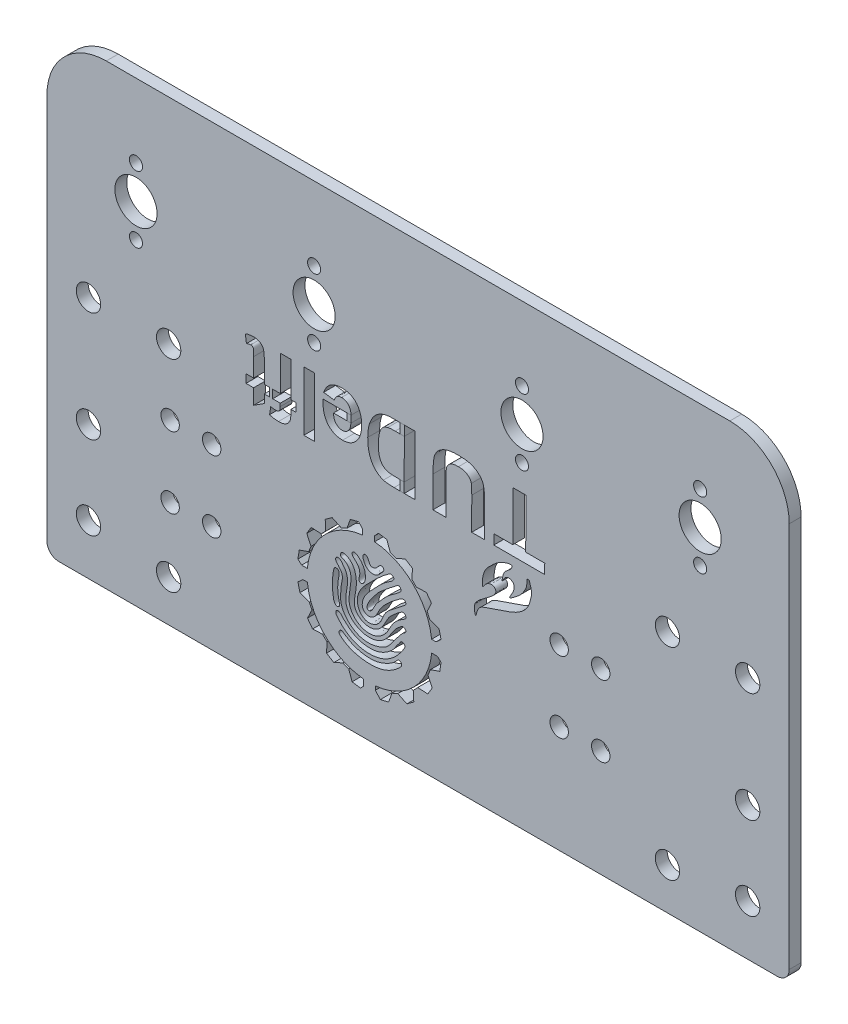
from build123d import *

# Parameters (mm, degrees)
SKETCH1_W             = 125
SKETCH1_H             = 77
SKETCH1_R             = 3.55
SKETCH1_R_2           = 1.1
SKETCH1_R_3           = 2.05
SKETCH1_R_4           = 1.55
BOSS_EXTRUDE1_DEPTH   = 2
FILLET1_R             = 10
FILLET2_R             = 2
CUT_EXTRUDE1_START    = -2
CUT_EXTRUDE1_DEPTH    = 2
SKETCH4_W             = 0.7
SKETCH4_H             = 1.666262253
BOSS_EXTRUDE2_DEPTH   = 2
SKETCH4_W_2           = 0.689492997
SKETCH4_H_2           = 1.664070352
BOSS_EXTRUDE2_2_DEPTH = 2
SKETCH4_H_3           = 1.151697465
BOSS_EXTRUDE2_3_DEPTH = 2
CUT_EXTRUDE3_DEPTH    = 147.826428278
SKETCH8_W             = 2
SKETCH8_H             = 2
BOSS_EXTRUDE3_DEPTH   = 2


# Read off the part's stored shape, not the designer's step: Cut-Extrude1
with BuildPart() as part:
    # Sketch1 → Boss-Extrude1 (new body)
    with BuildSketch(Plane.XY):
        with Locations((62.5, 38.5)):
            Rectangle(SKETCH1_W, SKETCH1_H)
        with Locations((15, 59)):
            Circle(SKETCH1_R, mode=Mode.SUBTRACT)
        with Locations((45, 59)):
            Circle(SKETCH1_R, mode=Mode.SUBTRACT)
        with Locations((80, 59)):
            Circle(SKETCH1_R, mode=Mode.SUBTRACT)
        with Locations((110, 59)):
            Circle(SKETCH1_R, mode=Mode.SUBTRACT)
        with Locations((15, 64.6)):
            Circle(SKETCH1_R_2, mode=Mode.SUBTRACT)
        with Locations((45, 64.6)):
            Circle(SKETCH1_R_2, mode=Mode.SUBTRACT)
        with Locations((80, 64.6)):
            Circle(SKETCH1_R_2, mode=Mode.SUBTRACT)
        with Locations((110, 64.6)):
            Circle(SKETCH1_R_2, mode=Mode.SUBTRACT)
        with Locations(Location((110, 53.4, 0), (0, 0, 180))):
            Circle(SKETCH1_R_2, mode=Mode.SUBTRACT)
        with Locations(Location((80, 53.4, 0), (0, 0, 180))):
            Circle(SKETCH1_R_2, mode=Mode.SUBTRACT)
        with Locations(Location((45, 53.4, 0), (0, 0, 180))):
            Circle(SKETCH1_R_2, mode=Mode.SUBTRACT)
        with Locations(Location((15, 53.4, 0), (0, 0, 180))):
            Circle(SKETCH1_R_2, mode=Mode.SUBTRACT)
        with Locations((7, 8.5)):
            Circle(SKETCH1_R_3, mode=Mode.SUBTRACT)
        with Locations((7, 22.5)):
            Circle(SKETCH1_R_3, mode=Mode.SUBTRACT)
        with Locations(Location((118, 8.5, 0), (0, 0, 180))):
            Circle(SKETCH1_R_3, mode=Mode.SUBTRACT)
        with Locations(Location((118, 22.5, 0), (0, 0, 180))):
            Circle(SKETCH1_R_3, mode=Mode.SUBTRACT)
        with Locations((20.5, 7)):
            Circle(SKETCH1_R_3, mode=Mode.SUBTRACT)
        with Locations((20.5, 41)):
            Circle(SKETCH1_R_3, mode=Mode.SUBTRACT)
        with Locations(Location((104.5, 7, 0), (0, 0, 180))):
            Circle(SKETCH1_R_3, mode=Mode.SUBTRACT)
        with Locations(Location((104.5, 41, 0), (0, 0, 180))):
            Circle(SKETCH1_R_3, mode=Mode.SUBTRACT)
        with Locations((20.75, 18)):
            Circle(SKETCH1_R_4, mode=Mode.SUBTRACT)
        with Locations((20.75, 30)):
            Circle(SKETCH1_R_4, mode=Mode.SUBTRACT)
        with Locations(Location((27.75, 18, 0), (0, 0, 180))):
            Circle(SKETCH1_R_4, mode=Mode.SUBTRACT)
        with Locations(Location((27.75, 30, 0), (0, 0, 180))):
            Circle(SKETCH1_R_4, mode=Mode.SUBTRACT)
        with Locations(Location((93.26, 18, 0), (0, 0, 180))):
            Circle(SKETCH1_R_4, mode=Mode.SUBTRACT)
        with Locations((86.26, 18)):
            Circle(SKETCH1_R_4, mode=Mode.SUBTRACT)
        with Locations((86.26, 30)):
            Circle(SKETCH1_R_4, mode=Mode.SUBTRACT)
        with Locations(Location((93.26, 30, 0), (0, 0, 180))):
            Circle(SKETCH1_R_4, mode=Mode.SUBTRACT)
        with Locations((7, 41)):
            Circle(SKETCH1_R_3, mode=Mode.SUBTRACT)
        with Locations(Location((118, 41, 0), (0, 0, 180))):
            Circle(SKETCH1_R_3, mode=Mode.SUBTRACT)
    extrude(amount=BOSS_EXTRUDE1_DEPTH)

    # Fillet1
    fillet1_edges = [part.edges().sort_by_distance(p)[0] for p in [
        (0, 77, 1),
        (125, 77, 1),
    ]]
    fillet(fillet1_edges, radius=FILLET1_R)

    # Fillet2
    fillet2_edges = [part.edges().sort_by_distance(p)[0] for p in [
        (125, 0, 1),
        (0, 0, 1),
    ]]
    fillet(fillet2_edges, radius=FILLET2_R)

    # Cut-Extrude1 outline → Cut-Extrude1 (cut)
    # profile 1 of 8: a face of its own
    with BuildSketch(Plane.XY.offset(2).offset(CUT_EXTRUDE1_START)):
        with BuildLine():
            add(Edge.make_bspline(
                [(81.251849288, 36.779414646), (81.247492129, 36.793378665), (81.207860576, 36.920021075), (80.799858004, 36.936688031), (80.821470647, 36.158449824), (80.80355112, 35.72482003), (80.374288953, 34.842498814), (79.881322011, 33.965258168), (77.381519863, 32.108766034), (78.597227158, 33.814279643), (78.956419225, 35.207259954), (77.21487199, 35.799499393), (76.547216037, 34.009253907), (76.81133602, 35.721809813), (77.177430618, 36.200279324), (78.069672729, 36.842957133), (78.761206511, 37.9588554), (76.100214252, 37.11203143), (74.944444523, 35.895544614), (73.336810133, 34.586035364), (73.207606047, 31.368349434), (73.760556003, 32.595590649), (74.936894361, 33.354106323), (76.139314494, 32.483671262), (74.151639075, 30.665966882), (72.784475727, 29.925580038), (72.088655851, 28.969143053), (71.914491564, 28.197404019), (72.183600749, 26.5403403), (72.500602899, 28.662113501), (73.965399773, 29.329932162), (76.951764861, 30.23566165), (79.0588748, 31.040106485), (81.022711601, 32.13723034), (81.572119528, 34.925789731), (81.777134866, 35.095955911), (81.251849288, 36.779414646)],
                knots=[0, 0, 0, 0, 0.00044067, 0.003966029, 0.005792626, 0.016880037, 0.021185448, 0.047460814, 0.081891789, 0.097295951, 0.12222596, 0.142929522, 0.159138332, 0.171893127, 0.194958669, 0.199517328, 0.21747972, 0.249139263, 0.287651076, 0.330737406, 0.364299818, 0.378924647, 0.385204396, 0.4270973, 0.476991153, 0.564177334, 0.57652011, 0.582583858, 0.624814808, 0.652752163, 0.702203053, 0.787421301, 0.811298129, 0.926563203, 0.946874204, 1, 1, 1, 1], degree=3))
        make_face()
    # profile 2 of 8: a face of its own
    with BuildSketch(Plane.XY.offset(2).offset(CUT_EXTRUDE1_START)):
        with BuildLine():
            add(Edge.make_bspline(
                [(41.084474532, 41.207127847), (41.084386211, 41.13639444), (41.084214466, 40.998851018), (41.072629339, 40.800050181), (41.059076668, 40.614441854), (41.03958516, 40.443364582), (41.012057676, 40.286186183), (40.984373097, 40.142289427), (40.944217791, 40.013516474), (40.890388325, 39.858880565), (40.794162454, 39.683342625), (40.644669499, 39.492268284), (40.452029215, 39.326786864), (40.22645285, 39.180257381), (39.965576689, 39.059669154), (39.66860801, 38.978433696), (39.341608255, 38.925362291), (39.11239838, 38.921064057), (38.993413093, 38.918832797)],
                knots=[0, 0, 0, 0, 0.058895809, 0.114524827, 0.165787414, 0.213890617, 0.257824887, 0.298686706, 0.335778729, 0.370050499, 0.434924525, 0.501392028, 0.571063427, 0.645341039, 0.724890297, 0.809297033, 0.901004059, 1, 1, 1, 1], degree=3))
            Line((41.084474532, 41.207127847), (41.085304863, 41.733492593))
            Line((41.085304863, 41.733492593), (41.981926178, 41.732078188))
            Line((41.981926178, 41.732078188), (41.984148814, 43.141054541))
            Line((41.984148814, 43.141054541), (41.087527498, 43.142468945))
            Line((41.087527498, 43.142468945), (41.096822155, 49.034551874))
            Line((41.096822155, 49.034551874), (39.303579524, 49.037380683))
            Line((39.303579524, 49.037380683), (39.294284868, 43.145297754))
            Line((39.294284868, 43.145297754), (38.013397274, 43.147318331))
            Line((38.013397274, 43.147318331), (38.011174639, 41.738341978))
            Line((38.011174639, 41.738341978), (39.292062233, 41.736321401))
            Line((39.292062233, 41.736321401), (39.291279259, 41.239977459))
            add(Edge.make_bspline(
                [(38.539319523, 40.32852898), (38.601489516, 40.330662211), (38.71756742, 40.334645175), (38.879621508, 40.366418581), (39.012815429, 40.427170666), (39.123759743, 40.512134412), (39.202313777, 40.637874365), (39.25404868, 40.801664113), (39.287643389, 41.006505305), (39.289999029, 41.157769338), (39.291279259, 41.239977459)],
                knots=[0, 0, 0, 0, 0.134991868, 0.252043989, 0.35574181, 0.450528209, 0.550967798, 0.671899199, 0.821685633, 1, 1, 1, 1], degree=3))
            add(Edge.make_bspline(
                [(37.688900592, 40.437945661), (37.833031986, 40.405693858), (38.113180047, 40.343006059), (38.400042773, 40.333260578), (38.539319523, 40.32852898)],
                knots=[0, 0, 0, 0, 0.514482929, 1, 1, 1, 1], degree=3))
            Line((37.688900592, 40.437945661), (37.494743718, 39.155359767))
            add(Edge.make_bspline(
                [(38.993413093, 38.918832797), (38.866526539, 38.921539382), (38.613318059, 38.926940508), (38.235394177, 38.973883704), (37.861148771, 39.046880828), (37.61694527, 39.119180423), (37.494743718, 39.155359767)],
                knots=[0, 0, 0, 0, 0.249849339, 0.498586885, 0.749088524, 1, 1, 1, 1], degree=3))
        make_face()
    # profile 3 of 8: a face of its own
    with BuildSketch(Plane.XY.offset(2).offset(CUT_EXTRUDE1_START)):
        with BuildLine():
            add(Edge.make_bspline(
                [(34.816128706, 46.290544378), (34.8164704, 46.365930753), (34.817114494, 46.50803407), (34.814668856, 46.708837054), (34.813657466, 46.884980939), (34.810212631, 47.036464306), (34.804111519, 47.163205208), (34.798269648, 47.264621911), (34.793415461, 47.341541208), (34.780363137, 47.434961247), (34.732204272, 47.548402483), (34.647236215, 47.649596669), (34.559367743, 47.707818909), (34.486379122, 47.740168864), (34.406697809, 47.761715023), (34.350938704, 47.763450668), (34.322108428, 47.764348084)],
                knots=[0, 0, 0, 0, 0.129479547, 0.244068946, 0.344909085, 0.432022823, 0.504292334, 0.562831021, 0.606508296, 0.636650554, 0.72452958, 0.813890151, 0.859335254, 0.904475985, 0.950609254, 1, 1, 1, 1], degree=3))
            Line((34.816128706, 46.290544378), (34.811178291, 43.152369775))
            Line((34.811178291, 43.152369775), (33.530290698, 43.154390352))
            Line((33.530290698, 43.154390352), (33.528068063, 41.745414))
            Line((33.528068063, 41.745414), (34.808955656, 41.743393422))
            Line((34.808955656, 41.743393422), (34.804914501, 39.181618235))
            Line((34.804914501, 39.181618235), (36.599975651, 40.331588261))
            Line((36.599975651, 40.331588261), (36.602198287, 41.740564614))
            Line((36.602198287, 41.740564614), (37.498819602, 41.739150209))
            Line((37.498819602, 41.739150209), (37.501042237, 43.148126562))
            Line((37.501042237, 43.148126562), (36.604420922, 43.149540966))
            Line((36.604420922, 43.149540966), (36.60952288, 46.383782139))
            add(Edge.make_bspline(
                [(36.553664253, 47.76683202), (36.558571956, 47.734839262), (36.56947969, 47.663732985), (36.58043371, 47.545441011), (36.590137101, 47.405293071), (36.597586153, 47.2431197), (36.603345354, 47.058962959), (36.606063088, 46.853445392), (36.611130656, 46.625971122), (36.610076495, 46.467176484), (36.60952288, 46.383782139)],
                knots=[0, 0, 0, 0, 0.070080146, 0.155758322, 0.257146461, 0.374311476, 0.507296469, 0.656130797, 0.819409856, 1, 1, 1, 1], degree=3))
            add(Edge.make_bspline(
                [(34.842690261, 49.172506735), (34.922170968, 49.169816), (35.077781056, 49.164547988), (35.306137774, 49.13232797), (35.522148287, 49.075978372), (35.723588927, 48.998402062), (35.904455388, 48.901888706), (36.064878532, 48.795254689), (36.195946503, 48.670467498), (36.306349438, 48.533632365), (36.389951206, 48.373126632), (36.461581205, 48.193566866), (36.517295585, 47.988541646), (36.541141329, 47.843173908), (36.553664253, 47.76683202)],
                knots=[0, 0, 0, 0, 0.096742541, 0.189405906, 0.279993555, 0.367899867, 0.451434128, 0.529129617, 0.601505434, 0.670867358, 0.742081635, 0.820784529, 0.905882505, 1, 1, 1, 1], degree=3))
            add(Edge.make_bspline(
                [(33.411297694, 48.920587967), (33.519311968, 48.960416787), (33.738467854, 49.041227591), (34.088785913, 49.114993226), (34.458257379, 49.164844967), (34.712408603, 49.169910214), (34.842690261, 49.172506735)],
                knots=[0, 0, 0, 0, 0.235963478, 0.478758812, 0.732804096, 1, 1, 1, 1], degree=3))
            Line((33.411297694, 48.920587967), (33.601318698, 47.581357068))
            add(Edge.make_bspline(
                [(34.322108428, 47.764348084), (34.275934833, 47.761488572), (34.173279176, 47.755131149), (34.006456097, 47.718279215), (33.812283849, 47.659678969), (33.675132345, 47.608760765), (33.601318698, 47.581357068)],
                knots=[0, 0, 0, 0, 0.185578673, 0.412588643, 0.683860748, 1, 1, 1, 1], degree=3))
        make_face()
    # profile 4 of 8: a face of its own
    with BuildSketch(Plane.XY.offset(2).offset(CUT_EXTRUDE1_START)):
        with BuildLine():
            add(Edge.make_bspline(
                [(49.628715168, 47.740202184), (49.555783864, 47.737083644), (49.41452681, 47.731043497), (49.210859288, 47.687483307), (49.026005996, 47.61044408), (48.858035934, 47.502900698), (48.708501509, 47.359966956), (48.583034074, 47.177809426), (48.473245316, 46.962134275), (48.421444479, 46.801686421), (48.394244397, 46.717436915)],
                knots=[0, 0, 0, 0, 0.125553796, 0.243178969, 0.35646636, 0.468629864, 0.584815746, 0.710080156, 0.847766094, 1, 1, 1, 1], degree=3))
            add(Edge.make_bspline(
                [(51.210984756, 45.944459089), (51.207942269, 46.013233429), (51.202017572, 46.147159131), (51.179083927, 46.342944837), (51.139136344, 46.526238455), (51.086750677, 46.698144405), (51.02438996, 46.85877937), (50.944973054, 47.006612968), (50.853421857, 47.143521802), (50.747528452, 47.267279128), (50.631543413, 47.37717392), (50.509122548, 47.473782948), (50.380455875, 47.558293976), (50.24220302, 47.622633727), (50.098979942, 47.677003168), (49.948191882, 47.711946242), (49.790860771, 47.735255968), (49.683503507, 47.738530878), (49.628715168, 47.740202184)],
                knots=[0, 0, 0, 0, 0.076984766, 0.149914034, 0.220164116, 0.286488465, 0.350779578, 0.412535306, 0.473793179, 0.534654409, 0.594295888, 0.652213479, 0.708926548, 0.765996814, 0.822414602, 0.879965744, 0.938742127, 1, 1, 1, 1], degree=3))
            Line((51.210984756, 45.944459089), (46.471700661, 45.951935225))
            add(Edge.make_bspline(
                [(49.791135666, 41.591670221), (49.664204995, 41.594596458), (49.41663849, 41.600303812), (49.055292437, 41.652566807), (48.714195643, 41.735920003), (48.394263121, 41.855269959), (48.09501605, 42.007395328), (47.815688028, 42.192160537), (47.558495866, 42.413434626), (47.321527556, 42.666134855), (47.111182208, 42.954827547), (46.928434542, 43.277784846), (46.777116464, 43.636894762), (46.656841781, 44.031771805), (46.563562367, 44.461612268), (46.50179166, 44.927510583), (46.46814644, 45.428376128), (46.470491111, 45.773760907), (46.471700661, 45.951935225)],
                knots=[0, 0, 0, 0, 0.060948577, 0.118874548, 0.174997402, 0.229351824, 0.282528423, 0.335951703, 0.389834463, 0.445160999, 0.502020273, 0.561013676, 0.62304474, 0.688834325, 0.759055579, 0.834115092, 0.91442463, 1, 1, 1, 1], degree=3))
            add(Edge.make_bspline(
                [(53.00340337, 45.419268309), (53.00055125, 45.273742332), (52.994978425, 44.989395714), (52.952522124, 44.575064033), (52.879979751, 44.184963903), (52.779517205, 43.820209902), (52.652773985, 43.478684456), (52.496748886, 43.161396121), (52.308275057, 42.870524864), (52.09629451, 42.604291718), (51.86137879, 42.367129407), (51.611497543, 42.157903324), (51.343911576, 41.983125233), (51.063364796, 41.837967884), (50.765595819, 41.728451957), (50.454448135, 41.648776828), (50.127623502, 41.599862498), (49.904726607, 41.594435755), (49.791135666, 41.591670221)],
                knots=[0, 0, 0, 0, 0.077699473, 0.151818822, 0.222108436, 0.289345562, 0.353596554, 0.416366914, 0.477732636, 0.538318944, 0.597768744, 0.655695171, 0.712013142, 0.768095143, 0.824007175, 0.881032759, 0.939372861, 1, 1, 1, 1], degree=3))
            add(Edge.make_bspline(
                [(52.318856943, 47.912081015), (52.374714468, 47.828405543), (52.487123124, 47.660015567), (52.621157658, 47.384633845), (52.744356123, 47.098186174), (52.837015025, 46.792618447), (52.915210047, 46.472915417), (52.963238858, 46.13558416), (52.999905415, 45.783017922), (53.002221875, 45.542131004), (53.00340337, 45.419268309)],
                knots=[0, 0, 0, 0, 0.114813113, 0.231051905, 0.349253341, 0.470748643, 0.595352963, 0.724928543, 0.859701718, 1, 1, 1, 1], degree=3))
            add(Edge.make_bspline(
                [(49.63293919, 49.149175379), (49.779237031, 49.145181966), (50.063699859, 49.137417138), (50.475509935, 49.077930402), (50.858291241, 48.982137212), (51.212261928, 48.847116313), (51.536441448, 48.671644124), (51.830522065, 48.456941785), (52.096454452, 48.205303941), (52.24420579, 48.010503606), (52.318856943, 47.912081015)],
                knots=[0, 0, 0, 0, 0.142445669, 0.276972629, 0.404305661, 0.526062398, 0.64497022, 0.762201009, 0.8798524, 1, 1, 1, 1], degree=3))
            add(Edge.make_bspline(
                [(46.601405882, 46.976443242), (46.631646302, 47.062934585), (46.69107156, 47.232898178), (46.800161094, 47.475530442), (46.923083721, 47.701201087), (47.055849562, 47.913138956), (47.201362321, 48.109612196), (47.363748792, 48.287564092), (47.535102268, 48.452314688), (47.720922927, 48.59855289), (47.918047147, 48.728498014), (48.126581434, 48.844054356), (48.349953378, 48.93601293), (48.583309459, 49.014428103), (48.828170055, 49.076345014), (49.085885135, 49.119606245), (49.355514553, 49.145597863), (49.539478334, 49.147970159), (49.63293919, 49.149175379)],
                knots=[0, 0, 0, 0, 0.068274766, 0.134166313, 0.198024248, 0.259697498, 0.320465937, 0.37997611, 0.439067186, 0.497470019, 0.555949018, 0.614924896, 0.674867742, 0.735725641, 0.79832223, 0.862907926, 0.93035182, 1, 1, 1, 1], degree=3))
            Line((46.601405882, 46.976443242), (48.394244397, 46.717436915))
        make_face()
        with BuildLine():
            add(Edge.make_bspline(
                [(48.263124772, 44.796307583), (48.266319886, 44.725546404), (48.272542595, 44.587734067), (48.293233009, 44.386785691), (48.329000095, 44.199461383), (48.37615739, 44.024757016), (48.439195309, 43.864815267), (48.509619531, 43.715068221), (48.596062737, 43.580161565), (48.695139658, 43.460410284), (48.799676945, 43.350931705), (48.915280855, 43.25984794), (49.032186691, 43.178313608), (49.15645852, 43.113023905), (49.286806451, 43.063086675), (49.422787791, 43.026308216), (49.564646163, 43.006491929), (49.660548891, 43.002704483), (49.709300053, 43.000779174)],
                knots=[0, 0, 0, 0, 0.082314067, 0.160312394, 0.234515367, 0.303739451, 0.370257879, 0.434059549, 0.495782928, 0.555842936, 0.614505537, 0.67129378, 0.726558525, 0.779964725, 0.833958593, 0.888495238, 0.943317705, 1, 1, 1, 1], degree=3))
            Line((48.263124772, 44.796307583), (51.175142659, 44.791713926))
            add(Edge.make_bspline(
                [(50.764791804, 43.481449589), (50.798499114, 43.522722989), (50.865961323, 43.605328061), (50.950698338, 43.743063493), (51.020214397, 43.891891588), (51.079682518, 44.050725652), (51.122685252, 44.221357701), (51.15543918, 44.401742695), (51.173988781, 44.593196019), (51.174750799, 44.724296779), (51.175142659, 44.791713926)],
                knots=[0, 0, 0, 0, 0.113788546, 0.227737747, 0.344445213, 0.464424642, 0.589602597, 0.719927691, 0.855975845, 1, 1, 1, 1], degree=3))
            add(Edge.make_bspline(
                [(49.709300053, 43.000779174), (49.761404909, 43.002388237), (49.864080131, 43.005558976), (50.014676878, 43.02706671), (50.157448866, 43.065410567), (50.293478666, 43.117397278), (50.422479529, 43.18593742), (50.544452789, 43.270050604), (50.659855155, 43.368680613), (50.72941454, 43.443431815), (50.764791804, 43.481449589)],
                knots=[0, 0, 0, 0, 0.130439608, 0.257037763, 0.379787864, 0.499815079, 0.620848951, 0.744538465, 0.870074611, 1, 1, 1, 1], degree=3))
        make_face(mode=Mode.SUBTRACT)
    # profile 5 of 8: a face of its own
    with BuildSketch(Plane.XY.offset(2).offset(CUT_EXTRUDE1_START)):
        with BuildLine():
            add(Edge.make_bspline(
                [(58.463106569, 39.016208779), (58.367691167, 39.01630467), (58.182138731, 39.016491148), (57.912667021, 39.028666169), (57.660204705, 39.04094492), (57.426177482, 39.064648732), (57.209794425, 39.090092478), (57.011173659, 39.121502852), (56.830546549, 39.16228551), (56.716724754, 39.193985108), (56.66215832, 39.209181968)],
                knots=[0, 0, 0, 0, 0.157498755, 0.306284699, 0.445270422, 0.574698145, 0.694503961, 0.8049537, 0.906494349, 1, 1, 1, 1], degree=3))
            Line((58.463106569, 39.016208779), (61.959529421, 39.010693234))
            Line((61.959529421, 39.010693234), (61.975289925, 49.001616462))
            Line((61.975289925, 49.001616462), (58.376796343, 49.007293022))
            add(Edge.make_bspline(
                [(56.683288397, 48.797816965), (56.737792845, 48.815245295), (56.850437007, 48.851264369), (57.0298057, 48.890541712), (57.220747712, 48.930398962), (57.427141154, 48.955632838), (57.645130008, 48.980635441), (57.877602876, 48.995235854), (58.122522686, 49.005136607), (58.290723295, 49.006563063), (58.376796343, 49.007293022)],
                knots=[0, 0, 0, 0, 0.100143304, 0.206965838, 0.321285922, 0.441556868, 0.570818446, 0.7054832, 0.849287355, 1, 1, 1, 1], degree=3))
            add(Edge.make_bspline(
                [(55.337099878, 48.003386599), (55.425242531, 48.085801621), (55.606100703, 48.254907378), (55.925047352, 48.467088001), (56.286452626, 48.652042184), (56.547936984, 48.748096592), (56.683288397, 48.797816965)],
                knots=[0, 0, 0, 0, 0.229263329, 0.470420903, 0.725875459, 1, 1, 1, 1], degree=3))
            add(Edge.make_bspline(
                [(54.319612129, 46.239764061), (54.350340726, 46.328719181), (54.41068037, 46.503394263), (54.513077865, 46.757115358), (54.628275848, 46.996553742), (54.750256921, 47.224404214), (54.880049872, 47.440226127), (55.024001693, 47.639357697), (55.173535481, 47.829104125), (55.282780193, 47.945507444), (55.337099878, 48.003386599)],
                knots=[0, 0, 0, 0, 0.137464981, 0.269930575, 0.399394095, 0.525392931, 0.647397834, 0.766913743, 0.884102655, 1, 1, 1, 1], degree=3))
            add(Edge.make_bspline(
                [(54.026058138, 44.114748998), (54.029582636, 44.313020763), (54.036396549, 44.696339679), (54.091715425, 45.25021824), (54.181388093, 45.762886899), (54.274577124, 46.084391913), (54.319612129, 46.239764061)],
                knots=[0, 0, 0, 0, 0.276174146, 0.533927632, 0.774763498, 1, 1, 1, 1], degree=3))
            add(Edge.make_bspline(
                [(56.66215832, 39.209181968), (56.593933615, 39.232681992), (56.45812279, 39.279462078), (56.258723401, 39.360565368), (56.070087699, 39.460707424), (55.886096446, 39.567970835), (55.713259274, 39.692305468), (55.542916428, 39.82352826), (55.384946563, 39.972844731), (55.180320844, 40.185181375), (54.946088802, 40.478602066), (54.701421473, 40.867855817), (54.494496704, 41.294824593), (54.352059491, 41.676682692), (54.258379491, 42.002173736), (54.19357512, 42.26219831), (54.143698871, 42.53736204), (54.099416971, 42.825594522), (54.06612533, 43.128147339), (54.043722813, 43.444663901), (54.026559063, 43.774981678), (54.026227349, 43.999976866), (54.026058138, 44.114748998)],
                knots=[0, 0, 0, 0, 0.036202439, 0.072066022, 0.107842041, 0.143257734, 0.178820201, 0.214574295, 0.25104801, 0.287737606, 0.36248408, 0.438903065, 0.517935668, 0.600120023, 0.643014127, 0.687822829, 0.73449402, 0.783248844, 0.834106562, 0.887140144, 0.942429141, 1, 1, 1, 1], degree=3))
        make_face()
        with BuildLine():
            add(Edge.make_bspline(
                [(58.644356819, 47.341712935), (58.574975049, 47.341255722), (58.441537632, 47.340376396), (58.248657118, 47.33749403), (58.071217886, 47.329040725), (57.908256138, 47.320367748), (57.760203464, 47.305821962), (57.626453969, 47.291184202), (57.508268156, 47.271423103), (57.435320709, 47.255174879), (57.401344033, 47.247606957)],
                knots=[0, 0, 0, 0, 0.16665029, 0.320507595, 0.463259151, 0.593295127, 0.712397057, 0.820515924, 0.91640184, 1, 1, 1, 1], degree=3))
            Line((58.644356819, 47.341712935), (60.179420544, 47.339291399))
            Line((60.179420544, 47.339291399), (60.168913541, 40.678675914))
            Line((60.168913541, 40.678675914), (59.24427281, 40.680134518))
            add(Edge.make_bspline(
                [(57.557255226, 40.778862567), (57.597211466, 40.771115535), (57.685430749, 40.754010883), (57.831663276, 40.73422938), (58.003996769, 40.719041252), (58.202078943, 40.704087518), (58.426354335, 40.694950864), (58.675825003, 40.685815883), (58.951399556, 40.682239845), (59.143537745, 40.680858655), (59.24427281, 40.680134518)],
                knots=[0, 0, 0, 0, 0.072147201, 0.159293625, 0.261448492, 0.378832184, 0.511431112, 0.659349412, 0.821402194, 1, 1, 1, 1], degree=3))
            add(Edge.make_bspline(
                [(55.81915554, 44.019856394), (55.820206168, 43.925127532), (55.822241181, 43.741642437), (55.827388985, 43.475136207), (55.847395939, 43.22644403), (55.866679137, 42.993748969), (55.898045978, 42.778494923), (55.929203034, 42.578564772), (55.97434063, 42.39748148), (56.035857354, 42.181362219), (56.130804129, 41.938006698), (56.264403402, 41.674610237), (56.422409666, 41.446230273), (56.601313063, 41.250985668), (56.805436974, 41.088768543), (57.031018409, 40.952489834), (57.284049316, 40.847021046), (57.464512402, 40.801999731), (57.557255226, 40.778862567)],
                knots=[0, 0, 0, 0, 0.07050587, 0.136566365, 0.198290706, 0.256139694, 0.310273245, 0.360143254, 0.40662365, 0.449042148, 0.527317846, 0.600595683, 0.66835624, 0.733348443, 0.796927749, 0.861722441, 0.928936983, 1, 1, 1, 1], degree=3))
            add(Edge.make_bspline(
                [(57.401344033, 47.247606957), (57.320625479, 47.225632096), (57.163429305, 47.182836927), (56.943297045, 47.088101332), (56.745638377, 46.970933476), (56.563360815, 46.833466895), (56.399393514, 46.657629145), (56.258904866, 46.433958095), (56.133487207, 46.164620676), (56.041489387, 45.909953663), (55.979920454, 45.680270238), (55.933760635, 45.488747218), (55.902412006, 45.280233613), (55.869886655, 45.05780709), (55.85003787, 44.819832669), (55.829160162, 44.567210304), (55.823131095, 44.298726636), (55.820505937, 44.114581704), (55.81915554, 44.019856394)],
                knots=[0, 0, 0, 0, 0.063956491, 0.124552724, 0.182686246, 0.239458988, 0.298698223, 0.365533878, 0.440661442, 0.525754735, 0.572318898, 0.622596667, 0.676392596, 0.733572415, 0.794580114, 0.859066161, 0.927502747, 1, 1, 1, 1], degree=3))
        make_face(mode=Mode.SUBTRACT)
    # profile 6 of 8: a face of its own
    with BuildSketch(Plane.XY.offset(2).offset(CUT_EXTRUDE1_START)):
        with BuildLine():
            add(Edge.make_bspline(
                [(71.542743322, 44.450837505), (71.54240089, 44.553577352), (71.541747129, 44.749724622), (71.538272517, 45.029939196), (71.532647641, 45.281466091), (71.525827719, 45.505056389), (71.514122779, 45.699918049), (71.500208451, 45.866710692), (71.486423571, 46.005367084), (71.470449102, 46.087501409), (71.46332584, 46.124126367)],
                knots=[0, 0, 0, 0, 0.183781914, 0.350869906, 0.50127637, 0.633825743, 0.750994388, 0.850395225, 0.93328893, 1, 1, 1, 1], degree=3))
            Line((71.542743322, 44.450837505), (71.534190597, 39.029080489))
            Line((71.534190597, 39.029080489), (73.711699506, 39.025645507))
            Line((73.711699506, 39.025645507), (73.720072273, 44.333323472))
            add(Edge.make_bspline(
                [(73.507903661, 46.857413281), (73.525191934, 46.782148637), (73.561587014, 46.623702347), (73.603557777, 46.371586603), (73.642077137, 46.094039584), (73.669934668, 45.790714002), (73.694175168, 45.462448077), (73.708527926, 45.108656117), (73.718182479, 44.729662444), (73.719429677, 44.468092602), (73.720072273, 44.333323472)],
                knots=[0, 0, 0, 0, 0.091244687, 0.192087299, 0.301914335, 0.422334855, 0.551979857, 0.690883391, 0.840733259, 1, 1, 1, 1], degree=3))
            add(Edge.make_bspline(
                [(69.242554104, 49.151732673), (69.369314201, 49.150069273), (69.614238918, 49.146855267), (69.970094684, 49.133426399), (70.301801659, 49.106684051), (70.610923104, 49.070576638), (70.896132447, 49.024757036), (71.158379856, 48.969067707), (71.395863601, 48.900433704), (71.677914683, 48.800807707), (71.993129603, 48.64963567), (72.337401592, 48.449202827), (72.638399241, 48.22110265), (72.894869162, 47.969994107), (73.107989408, 47.702927319), (73.283986276, 47.428999438), (73.420614319, 47.1480961), (73.479167766, 46.953106875), (73.507903661, 46.857413281)],
                knots=[0, 0, 0, 0, 0.072638865, 0.140352161, 0.204001969, 0.263271099, 0.318637126, 0.369470808, 0.416780289, 0.460185144, 0.540734595, 0.616651901, 0.688135948, 0.7565267, 0.821778303, 0.883493225, 0.942822728, 1, 1, 1, 1], degree=3))
            add(Edge.make_bspline(
                [(65.009907196, 44.265006537), (65.010101635, 44.409114815), (65.010475267, 44.686029994), (65.022169681, 45.084307182), (65.036732017, 45.449888609), (65.053600701, 45.783024056), (65.08006614, 46.083327652), (65.112784155, 46.350132677), (65.14782091, 46.584777263), (65.203175412, 46.851086273), (65.293445934, 47.150757662), (65.441745224, 47.479416687), (65.624279954, 47.781425282), (65.850946938, 48.051002258), (66.113224544, 48.295305056), (66.418359984, 48.509744576), (66.762554712, 48.698751021), (67.077779965, 48.834101761), (67.352424492, 48.925733117), (67.576830836, 48.987576625), (67.816896638, 49.038712406), (68.072899781, 49.079903726), (68.343277816, 49.113447108), (68.629746209, 49.136833198), (68.93085568, 49.150465673), (69.137131124, 49.151304147), (69.242554104, 49.151732673)],
                knots=[0, 0, 0, 0, 0.056615941, 0.108791901, 0.156530833, 0.200366394, 0.239829976, 0.274941693, 0.305969129, 0.333008211, 0.381763123, 0.428575647, 0.474337337, 0.519944888, 0.566494713, 0.614788785, 0.666061564, 0.720542848, 0.749304353, 0.779764193, 0.811946961, 0.84568669, 0.881610792, 0.918962796, 0.958583613, 1, 1, 1, 1], degree=3))
            Line((65.009907196, 44.265006537), (65.001663871, 39.039385434))
            Line((65.001663871, 39.039385434), (67.17917278, 39.035950452))
            Line((67.17917278, 39.035950452), (67.18790862, 44.573787906))
            add(Edge.make_bspline(
                [(69.30597312, 47.486474615), (69.229230528, 47.485297188), (69.080243755, 47.483011352), (68.864218292, 47.468150505), (68.66250461, 47.439727331), (68.47562047, 47.403279256), (68.302763836, 47.35504448), (68.144610544, 47.296347072), (68.001440265, 47.223766582), (67.833141179, 47.116306097), (67.653288985, 46.962649766), (67.477845341, 46.755260996), (67.355273353, 46.523702421), (67.291902428, 46.31393333), (67.264998438, 46.129688503), (67.244584103, 45.969593449), (67.226322562, 45.788142856), (67.212209269, 45.58593129), (67.202662647, 45.363025162), (67.19358919, 45.118885417), (67.190020294, 44.853319238), (67.18862929, 44.669186131), (67.18790862, 44.573787906)],
                knots=[0, 0, 0, 0, 0.053901669, 0.104643791, 0.151955819, 0.196890302, 0.238274237, 0.277868856, 0.315167969, 0.350780909, 0.417916238, 0.480488381, 0.540435419, 0.600618206, 0.633356462, 0.671132232, 0.713978375, 0.761415524, 0.813477396, 0.870671306, 0.932995603, 1, 1, 1, 1], degree=3))
            add(Edge.make_bspline(
                [(71.46332584, 46.124126367), (71.435300144, 46.223044328), (71.379927353, 46.418485094), (71.229604538, 46.685451167), (71.02887105, 46.918901597), (70.82628438, 47.087500887), (70.64136048, 47.20321964), (70.486623147, 47.277653115), (70.320407892, 47.342650445), (70.140432537, 47.393106749), (69.949854402, 47.437201961), (69.746122187, 47.46356487), (69.53049092, 47.483103404), (69.382072511, 47.485331957), (69.30597312, 47.486474615)],
                knots=[0, 0, 0, 0, 0.110926452, 0.219166981, 0.328220233, 0.442534972, 0.502822786, 0.563832121, 0.628036664, 0.695651731, 0.765874577, 0.839469728, 0.917690426, 1, 1, 1, 1], degree=3))
        make_face()
    # profile 7 of 8: a face of its own
    with BuildSketch(Plane.XY.offset(2).offset(CUT_EXTRUDE1_START)):
        Polygon((80.644253013, 49.005657617), (78.466744105, 49.009092599), (78.453610351, 40.683323242), (75.251391368, 40.688374686), (75.248764617, 39.023220814), (83.830711493, 39.009682946), (83.833338243, 40.674836817), (80.63111926, 40.67988826), align=None)
    # profile 8 of 8: a face of its own
    with BuildSketch(Plane.XY.offset(2).offset(CUT_EXTRUDE1_START)):
        Polygon((45.067573694, 49.028288084), (43.274331063, 49.031116893), (43.258570559, 39.040193665), (45.05181319, 39.037364857), align=None)
    extrude(amount=CUT_EXTRUDE1_DEPTH, mode=Mode.SUBTRACT)

    # Sketch7 → Cut-Extrude3 (cut, through all)
    with BuildSketch(Plane.XY.offset(2)):
        with BuildLine():
            add(Edge.make_bspline(
                [(49.280002595, 13.02027984), (50.003556201, 12.325571309), (51.647181258, 11.509959362), (54.28082092, 11.142873832), (56.523082567, 11.372507809), (58.290934962, 12.243780832), (59.176365089, 12.992474418), (59.688914269, 13.514687666), (59.742857638, 13.830809783), (59.623367943, 14.174142032), (59.180646429, 14.303798091), (58.819057998, 13.888624683), (58.317418531, 13.363253155), (57.21480053, 12.716448351), (55.46329881, 12.00196938), (53.15212189, 12.064806382), (51.268290858, 12.671207498), (50.32669256, 13.353429125), (49.907456883, 13.579849971), (49.692519602, 13.828855543), (49.234514258, 13.664326615), (49.150443731, 13.291901367), (49.214414001, 13.0835437), (49.274028013, 13.02601624), (49.280002595, 13.02027984)],
                knots=[0, 0, 0, 0, 0.123617799, 0.221602489, 0.331388689, 0.399989775, 0.464416282, 0.477688817, 0.489276243, 0.502749585, 0.519975533, 0.534992446, 0.566611412, 0.613181845, 0.692427641, 0.801250786, 0.894671602, 0.935649171, 0.946142032, 0.954379959, 0.974702166, 0.989792536, 0.998979254, 1, 1, 1, 1], degree=3))
        make_face()
        with BuildLine():
            add(Edge.make_bspline(
                [(48.676274284, 15.723096809), (49.075320901, 15.130227549), (50.08804327, 14.052113697), (51.993613348, 12.96049927), (54.088584652, 12.593272272), (56.106124372, 12.836505413), (57.92065059, 13.700542566), (59.219689557, 14.977783237), (59.904463739, 15.999008389), (60.248945584, 16.485640113), (60.271589278, 16.704234857), (60.273435823, 16.97400961), (60.010024105, 17.15306565), (59.690993821, 17.193007323), (59.470641475, 16.990006316), (59.380459968, 16.735451403), (58.985722396, 16.360073359), (58.570197634, 15.565317166), (57.473992876, 14.493160229), (55.823300107, 13.57236773), (53.740058459, 13.508011588), (52.06512589, 13.916303195), (50.851788741, 14.764804051), (50.118345306, 15.432627773), (49.629308117, 15.923874117), (49.472038591, 16.184754886), (49.25500513, 16.273340916), (49.003302163, 16.403024642), (48.603061134, 16.215424313), (48.707966386, 15.935832033), (48.640782984, 15.775971581), (48.673040362, 15.727901493), (48.676274284, 15.723096809)],
                knots=[0, 0, 0, 0, 0.0765671, 0.148075805, 0.226147326, 0.29328444, 0.356571305, 0.431891597, 0.478709459, 0.486221718, 0.492465809, 0.50142136, 0.512376275, 0.521863884, 0.533078735, 0.539992765, 0.549828253, 0.588471721, 0.632509932, 0.707741068, 0.778832379, 0.844494369, 0.883183112, 0.93158107, 0.947499383, 0.955626493, 0.962146421, 0.971194927, 0.985286516, 0.99379491, 0.999379491, 1, 1, 1, 1], degree=3))
        make_face()
        with BuildLine():
            add(Edge.make_bspline(
                [(48.332995675, 22.098488573), (48.278445341, 21.805980517), (48.227227134, 21.716257438), (48.128639114, 21.002344465), (48.075464457, 20.219946386), (48.026199448, 19.178541351), (48.220320326, 18.210507611), (48.265510917, 17.521291908), (48.490124428, 17.146116513), (48.643403323, 16.941939721), (48.932272017, 16.819718741), (49.134069212, 16.998496224), (49.338139584, 17.185429031), (49.269419022, 17.530713867), (49.154589881, 18.020324611), (48.99494414, 18.79010865), (48.957326852, 19.721912508), (48.982308603, 20.671213511), (49.208253283, 21.369444128), (49.171349269, 21.839594939), (49.194333446, 22.090711832), (49.111713565, 22.334058774), (48.854933202, 22.424732533), (48.594398801, 22.443954377), (48.449221546, 22.334242116), (48.356290312, 22.18655596), (48.34610557, 22.169206512), (48.334174898, 22.104811761), (48.332995675, 22.098488573)],
                knots=[0, 0, 0, 0, 0.039337305, 0.080841207, 0.145529456, 0.24788503, 0.329045648, 0.39141106, 0.412960486, 0.435797179, 0.454185976, 0.482040777, 0.494323772, 0.520366408, 0.55782037, 0.624099965, 0.71065791, 0.788296616, 0.856828767, 0.888066498, 0.90348967, 0.918982555, 0.947219664, 0.963835479, 0.980987636, 0.991496399, 0.99914964, 1, 1, 1, 1], degree=3))
        make_face()
        with BuildLine():
            add(Edge.make_bspline(
                [(48.748708017, 23.328599538), (48.85495215, 23.180430915), (49.003895227, 23.08236243), (49.361297402, 22.600265415), (49.674353346, 22.184737953), (49.815505085, 21.424760787), (49.594496208, 20.651776212), (49.452938189, 19.217014965), (49.352626931, 17.89316612), (50.167025915, 16.169252106), (51.463517156, 14.809439828), (53.681929055, 14.05539084), (55.639654199, 14.359285534), (57.228838579, 15.02501049), (58.106286294, 16.199383973), (58.745246103, 17.061265604), (59.463545208, 18.018690557), (59.583285589, 18.133245819), (60.021126875, 18.60112422), (60.270659981, 18.700367109), (60.494430905, 18.95644346), (60.389886219, 19.262014455), (60.161246937, 19.452840947), (59.784048127, 19.475610846), (59.35389419, 19.100185974), (58.822165486, 18.689638992), (58.360874105, 18.027867071), (57.61674116, 16.816270697), (56.472443375, 15.43690714), (54.534142913, 15.015521125), (52.489419638, 15.213207449), (50.676959567, 16.633391472), (50.286769604, 18.393321873), (50.396886043, 19.866169994), (50.809743205, 21.303760474), (50.408162199, 22.777331099), (49.819328229, 23.50493476), (49.440416946, 24.029565323), (48.951355143, 24.157598717), (48.653723548, 23.954368215), (48.55748074, 23.615922726), (48.69193173, 23.407780045), (48.748708017, 23.328599538)],
                knots=[0, 0, 0, 0, 0.010532556, 0.029807496, 0.050000998, 0.062274906, 0.102667905, 0.12603117, 0.20293843, 0.224671408, 0.309434762, 0.376668303, 0.443220616, 0.497786948, 0.538750698, 0.58022407, 0.610025101, 0.63456477, 0.637772913, 0.642106534, 0.647893712, 0.652492746, 0.656498752, 0.66237215, 0.669484698, 0.683976113, 0.696244356, 0.709287503, 0.75578981, 0.779256342, 0.805537327, 0.857572753, 0.879538502, 0.893256076, 0.931289703, 0.952628772, 0.966066028, 0.978384069, 0.983674914, 0.989502154, 0.994371459, 1, 1, 1, 1], degree=3))
        make_face()
        with BuildLine():
            add(Edge.make_bspline(
                [(49.670611596, 24.419204692), (50.078608873, 24.26439051), (50.717830514, 23.880609454), (51.393437203, 22.391014694), (51.084890349, 20.909800763), (50.878369857, 19.40783443), (50.849434256, 18.152446757), (51.551137056, 16.835965267), (52.767170033, 15.901629334), (54.038626596, 15.590831839), (55.307877574, 15.737864315), (56.33118529, 16.28447202), (57.341920299, 17.272512715), (57.787234843, 18.357780268), (58.580114724, 19.541135222), (59.431339806, 20.24524625), (60.209807903, 20.671086019), (60.463913233, 20.935246703), (60.438460347, 21.207608806), (60.316852539, 21.543098704), (59.858431512, 21.606380908), (59.593183204, 21.375205279), (59.261633438, 21.180848328), (58.543878314, 20.592565313), (57.623316453, 19.850343711), (56.857215268, 18.263365583), (56.020008951, 16.94952313), (54.513687357, 16.5314044), (53.077693506, 16.666530329), (51.428576782, 18.15165702), (51.983576936, 20.220116509), (52.201523721, 22.208929427), (51.895283524, 23.980438586), (50.820711652, 24.962499398), (50.165575681, 25.179258947), (49.70676565, 25.26739503), (49.490895021, 25.011732222), (49.429556034, 24.774659152), (49.452611275, 24.497418172), (49.609703126, 24.442316354), (49.670611596, 24.419204692)],
                knots=[0, 0, 0, 0, 0.03039654, 0.053828409, 0.115133335, 0.136684318, 0.166575092, 0.205940494, 0.241347362, 0.277153177, 0.299377306, 0.334409381, 0.360467783, 0.402223603, 0.419394605, 0.465472122, 0.480785495, 0.486172897, 0.490561543, 0.500109788, 0.510087625, 0.51862512, 0.525347302, 0.538489989, 0.587096857, 0.609663484, 0.66895834, 0.692183833, 0.721346386, 0.773619649, 0.829646181, 0.864858298, 0.924483466, 0.952491089, 0.966066895, 0.976910501, 0.982808792, 0.988494377, 0.995462208, 1, 1, 1, 1], degree=3))
        make_face()
        with BuildLine():
            add(Edge.make_bspline(
                [(51.486862732, 25.588719023), (51.589157455, 25.43391117), (51.92265157, 25.140820686), (52.469134924, 24.638619853), (52.723438233, 23.858854148), (52.675949895, 23.212129164), (52.502634097, 22.786402879), (52.52982762, 22.386358809), (52.940148209, 22.202302922), (53.239626219, 22.39298862), (53.456562735, 22.661789508), (53.650761637, 23.168784007), (53.626608702, 23.819458436), (53.527019667, 24.575099995), (53.129428553, 25.207224074), (52.690378088, 25.763069685), (52.214739249, 26.105799887), (51.791457434, 26.307250428), (51.350930007, 26.096980825), (51.385856738, 25.760904736), (51.459976155, 25.62940786), (51.486862732, 25.588719023)],
                knots=[0, 0, 0, 0, 0.056744214, 0.132187381, 0.222424843, 0.293835558, 0.323122093, 0.362883994, 0.400364218, 0.435045193, 0.461649031, 0.505237635, 0.595423866, 0.65591722, 0.733596911, 0.817228495, 0.868875808, 0.911173107, 0.954061602, 0.985085666, 1, 1, 1, 1], degree=3))
        make_face()
        with BuildLine():
            add(Edge.make_bspline(
                [(53.285001222, 26.623551766), (53.233348494, 26.533044638), (53.187957448, 26.327381481), (53.270368637, 25.996799373), (53.433273883, 25.588064918), (53.714210591, 25.121158702), (54.263228403, 24.702317097), (54.931144235, 24.580586966), (55.605020355, 24.759788037), (56.035053644, 25.166250502), (56.362390448, 25.587816009), (56.705276453, 25.849521916), (56.768567245, 26.233128524), (56.582144675, 26.449704145), (56.303594348, 26.557620497), (55.974332591, 26.404592381), (55.702288606, 26.050703843), (55.391844889, 25.718280599), (54.935907614, 25.548536991), (54.441562221, 25.593309675), (54.260585472, 26.034676468), (54.098493378, 26.404958109), (53.892448007, 26.75826777), (53.496023801, 26.873385681), (53.333856813, 26.709157685), (53.285001222, 26.623551766)],
                knots=[0, 0, 0, 0, 0.029925862, 0.060815036, 0.099766941, 0.161626652, 0.220619714, 0.30058617, 0.354545204, 0.422906104, 0.471676955, 0.514924843, 0.547417663, 0.574044317, 0.593424318, 0.633209384, 0.669558723, 0.728458614, 0.763803772, 0.814566683, 0.854560895, 0.894685471, 0.938865285, 0.971694706, 1, 1, 1, 1], degree=3))
        make_face()
        with BuildLine():
            add(Edge.make_bspline(
                [(57.662405711, 26.026385004), (56.783292064, 25.460020603), (55.68569367, 24.418432268), (53.738492018, 22.531556068), (52.045493002, 20.642406912), (52.377110126, 18.197864229), (53.681503633, 17.023279286), (55.223887137, 17.269712009), (56.166297159, 18.136655758), (56.534399682, 19.078667639), (56.94866594, 20.032585083), (57.988267955, 21.028157078), (59.18595587, 21.859882967), (60.061985193, 22.548605356), (60.4571372, 22.906760986), (60.453825464, 23.229622213), (60.180125523, 23.574858578), (59.555716838, 23.367560406), (58.718292831, 22.739364637), (57.352014326, 21.647535147), (56.02464008, 20.239072237), (55.462099532, 18.670534087), (54.273496568, 17.869710391), (52.950130596, 18.674982589), (53.180901751, 20.261989153), (54.065473833, 21.584906165), (55.23035837, 22.698417413), (56.27958421, 23.87620065), (57.222447598, 24.623966371), (57.976097613, 25.069952977), (58.287686522, 25.36772581), (58.506762921, 25.706546965), (58.246289929, 26.073179718), (57.884069968, 26.166615356), (57.714786823, 26.060131264), (57.662405711, 26.026385004)],
                knots=[0, 0, 0, 0, 0.075535433, 0.111514781, 0.2023572, 0.244457941, 0.279741709, 0.319600919, 0.346351014, 0.370988865, 0.393398222, 0.42234018, 0.475203634, 0.500387671, 0.506136733, 0.512765915, 0.522174328, 0.533678558, 0.554926854, 0.602081227, 0.661432479, 0.694032924, 0.724255533, 0.752241783, 0.786127318, 0.827121976, 0.870548758, 0.904051224, 0.943306286, 0.958955224, 0.967832641, 0.975704108, 0.985587316, 0.995499296, 1, 1, 1, 1], degree=3))
        make_face()
        with BuildLine():
            add(Edge.make_bspline(
                [(58.988371854, 24.99748603), (58.384939078, 24.571294675), (57.401336518, 23.724455034), (55.763930009, 22.48319781), (54.749623955, 20.969629547), (53.953213888, 19.925560051), (53.866422172, 19.056784399), (54.359736524, 18.926558734), (54.764092073, 19.242592168), (55.026947529, 19.80080475), (55.477881199, 20.61163941), (56.483074435, 21.749169459), (57.663051905, 23.014830976), (58.910777687, 23.750834538), (59.406222916, 24.251125456), (59.749777827, 24.508847731), (59.567527919, 24.851792719), (59.388382241, 25.090113457), (59.124484016, 25.092793269), (59.023107742, 25.022019226), (58.988371854, 24.99748603)],
                knots=[0, 0, 0, 0, 0.12866295, 0.228175891, 0.357606966, 0.44107941, 0.465087959, 0.487136654, 0.511343788, 0.549300478, 0.594525899, 0.673462456, 0.813571721, 0.897873517, 0.918971659, 0.942396823, 0.959596393, 0.97848488, 0.992593671, 1, 1, 1, 1], degree=3))
        make_face()
        with BuildLine():
            Line((54.686027669, 29.793420245), (55.826618597, 31.041841409))
            Line((55.826618597, 31.041841409), (57.248770718, 30.822383406))
            Line((57.248770718, 30.822383406), (57.817788589, 29.218480932))
            ThreePointArc((57.817788589, 29.218480932), (58.309967065, 29.036787451), (58.792750387, 28.831428163))
            Line((58.792750387, 28.831428163), (60.324269097, 29.548333673))
            Line((60.324269097, 29.548333673), (61.554183392, 28.801346861))
            Line((61.554183392, 28.801346861), (61.466100453, 27.101780482))
            ThreePointArc((61.466100453, 27.101780482), (61.851282988, 26.745569045), (62.218729021, 26.371088623))
            Line((62.218729021, 26.371088623), (63.908015672, 26.447336114))
            Line((63.908015672, 26.447336114), (64.758448839, 25.286542463))
            Line((64.758448839, 25.286542463), (64.026674918, 23.750055752))
            ThreePointArc((64.026674918, 23.750055752), (64.246220964, 23.273556322), (64.44238938, 22.786966015))
            Line((64.44238938, 22.786966015), (66.032265392, 22.210947498))
            Line((66.032265392, 22.210947498), (66.37374669, 20.813067319))
            Line((66.37374669, 20.813067319), (65.109687734, 19.673576451))
            Line((65.109687734, 19.673576451), (64.808820881, 19.673576451))
            ThreePointArc((64.808820881, 19.673576451), (61.634499119, 26.537556395), (54.673650879, 29.493420245))
            Line((54.673650879, 29.493420245), (54.686027669, 29.793420245))
        make_face()
        with BuildLine():
            Line((65.125199331, 18.624710518), (66.373620494, 17.48411959))
            Line((66.373620494, 17.48411959), (66.154162492, 16.061967469))
            Line((66.154162492, 16.061967469), (64.550260018, 15.492949598))
            ThreePointArc((64.550260018, 15.492949598), (64.368566537, 15.000771122), (64.163207249, 14.517987799))
            Line((64.163207249, 14.517987799), (64.880112759, 12.98646909))
            Line((64.880112759, 12.98646909), (64.133125946, 11.756554795))
            Line((64.133125946, 11.756554795), (62.433559567, 11.844637734))
            ThreePointArc((62.433559567, 11.844637734), (62.07734813, 11.459455199), (61.702867708, 11.092009166))
            Line((61.702867708, 11.092009166), (61.779115199, 9.402722515))
            Line((61.779115199, 9.402722515), (60.618321548, 8.552289348))
            Line((60.618321548, 8.552289348), (59.081834838, 9.284063269))
            ThreePointArc((59.081834838, 9.284063269), (58.605335407, 9.064517223), (58.118745101, 8.868348807))
            Line((58.118745101, 8.868348807), (57.542726583, 7.278472795))
            Line((57.542726583, 7.278472795), (56.144846405, 6.936991497))
            Line((56.144846405, 6.936991497), (55.005355536, 8.201050452))
            Line((55.005355536, 8.201050452), (55.005355536, 8.501917306))
            ThreePointArc((55.005355536, 8.501917306), (61.86502549, 11.6717933), (64.824776807, 18.624710518))
            Line((64.824776807, 18.624710518), (65.125199331, 18.624710518))
        make_face()
        with BuildLine():
            Line((53.956489604, 8.185538856), (52.815898676, 6.937117692))
            Line((52.815898676, 6.937117692), (51.393746554, 7.156575695))
            Line((51.393746554, 7.156575695), (50.824728683, 8.760478169))
            ThreePointArc((50.824728683, 8.760478169), (50.332550207, 8.94217165), (49.849766885, 9.147530938))
            Line((49.849766885, 9.147530938), (48.318248175, 8.430625428))
            Line((48.318248175, 8.430625428), (47.08833388, 9.17761224))
            Line((47.08833388, 9.17761224), (47.17641682, 10.87717862))
            ThreePointArc((47.17641682, 10.87717862), (46.791234284, 11.233390057), (46.423788251, 11.607870478))
            Line((46.423788251, 11.607870478), (44.734501601, 11.531622988))
            Line((44.734501601, 11.531622988), (43.884068434, 12.692416639))
            Line((43.884068434, 12.692416639), (44.615842354, 14.228903349))
            ThreePointArc((44.615842354, 14.228903349), (44.396296309, 14.70540278), (44.200127893, 15.191993086))
            Line((44.200127893, 15.191993086), (42.61025188, 15.768011603))
            Line((42.61025188, 15.768011603), (42.268770582, 17.165891782))
            Line((42.268770582, 17.165891782), (43.532829538, 18.30538265))
            Line((43.532829538, 18.30538265), (43.833696391, 18.30538265))
            ThreePointArc((43.833696391, 18.30538265), (47.003572386, 11.445712697), (53.956489604, 8.48596138))
            Line((53.956489604, 8.48596138), (53.956489604, 8.185538856))
        make_face()
        with BuildLine():
            Line((43.517317942, 19.354248583), (42.268896778, 20.494839511))
            Line((42.268896778, 20.494839511), (42.488354781, 21.916991633))
            Line((42.488354781, 21.916991633), (44.092257254, 22.486009503))
            ThreePointArc((44.092257254, 22.486009503), (44.273950736, 22.97818798), (44.479310023, 23.460971302))
            Line((44.479310023, 23.460971302), (43.762404514, 24.992490011))
            Line((43.762404514, 24.992490011), (44.509391326, 26.222404307))
            Line((44.509391326, 26.222404307), (46.208957705, 26.134321367))
            ThreePointArc((46.208957705, 26.134321367), (46.565169142, 26.519503903), (46.939649564, 26.886949936))
            Line((46.939649564, 26.886949936), (46.863402073, 28.576236586))
            Line((46.863402073, 28.576236586), (48.024195724, 29.426669753))
            Line((48.024195724, 29.426669753), (49.560682435, 28.694895833))
            ThreePointArc((49.560682435, 28.694895833), (50.037181865, 28.914441878), (50.523772171, 29.110610294))
            Line((50.523772171, 29.110610294), (51.099790689, 30.700486307))
            Line((51.099790689, 30.700486307), (52.497670868, 31.041967605))
            Line((52.497670868, 31.041967605), (53.637161736, 29.777908649))
            Line((53.637161736, 29.777908649), (53.637161736, 29.477041795))
            ThreePointArc((53.637161736, 29.477041795), (46.777491782, 26.307165801), (43.817740466, 19.354248583))
            Line((43.817740466, 19.354248583), (43.517317942, 19.354248583))
        make_face()
    extrude(amount=-CUT_EXTRUDE3_DEPTH, mode=Mode.SUBTRACT)

    # Sketch8 → Boss-Extrude3 (add)
    with BuildSketch(Plane.XY.offset(2)):
        with Locations((54.173650879, 29.985851559)):
            Rectangle(SKETCH8_W, SKETCH8_H)
        with Locations((65.235812916, 19.048013596)):
            Rectangle(SKETCH8_W, SKETCH8_H)
        with Locations((54.297974953, 7.985851559)):
            Rectangle(SKETCH8_W, SKETCH8_H)
        with Locations((43.235812916, 18.923689522)):
            Rectangle(SKETCH8_W, SKETCH8_H)
    extrude(amount=-BOSS_EXTRUDE3_DEPTH)


with BuildPart() as body_2:
    # Sketch4 → Boss-Extrude2 (new body)
    with BuildSketch(Plane.XY.offset(2)):
        with Locations((59.829420544, 48.172422526)):
            Rectangle(SKETCH4_W, SKETCH4_H)
    extrude(amount=-BOSS_EXTRUDE2_DEPTH)


with BuildPart() as body_3:
    # Sketch4 → Boss-Extrude2 2 (new body)
    with BuildSketch(Plane.XY.offset(2)):
        with Locations((59.824167043, 39.846640738)):
            Rectangle(SKETCH4_W_2, SKETCH4_H_2)
    extrude(amount=-BOSS_EXTRUDE2_2_DEPTH)


with BuildPart() as body_4:
    # Sketch4 → Boss-Extrude2 3 (new body)
    with BuildSketch(Plane.XY.offset(2)):
        with Locations((50.860984756, 45.368610356)):
            Rectangle(SKETCH4_W, SKETCH4_H_3)
    extrude(amount=-BOSS_EXTRUDE2_3_DEPTH)


solid = Compound([part.part, body_2.part, body_3.part, body_4.part])
